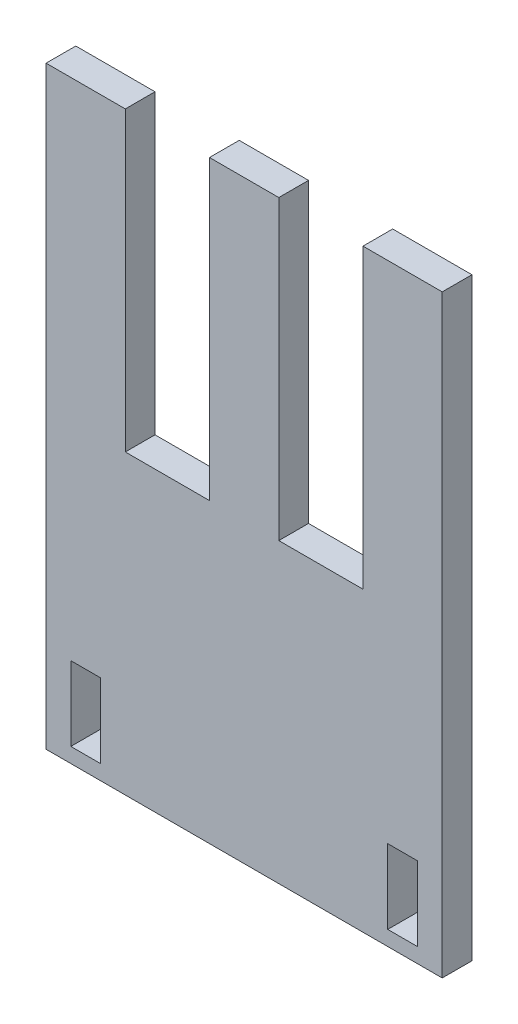
from build123d import *

# Parameters (mm, degrees)
ESQUISSE1_W        = 6
ESQUISSE1_H        = 15
BOSS_EXTRU_1_DEPTH = 6


with BuildPart() as part:
    # Esquisse1 → Boss.-Extru.1 (new body)
    with BuildSketch(Plane.XY):
        Polygon((7.067583758, 47.381284916), (7.067583758, -12.618715084), (-9.932416242, -12.618715084), (-9.932416242, 47.381284916), (-23.932416242, 47.381284916), (-23.932416242, -12.618715084), (-40.932416242, -12.618715084), (-40.932416242, 47.381284916), (-56.932416242, 47.381284916), (-56.932416242, -72.618715084), (23.067583758, -72.618715084), (23.067583758, 47.381284916), align=None)
        with Locations((15.067583758, -62.118715084)):
            Rectangle(ESQUISSE1_W, ESQUISSE1_H, mode=Mode.SUBTRACT)
        with Locations((-48.932416242, -62.118715084)):
            Rectangle(ESQUISSE1_W, ESQUISSE1_H, mode=Mode.SUBTRACT)
    extrude(amount=BOSS_EXTRU_1_DEPTH)


solid = part.part
